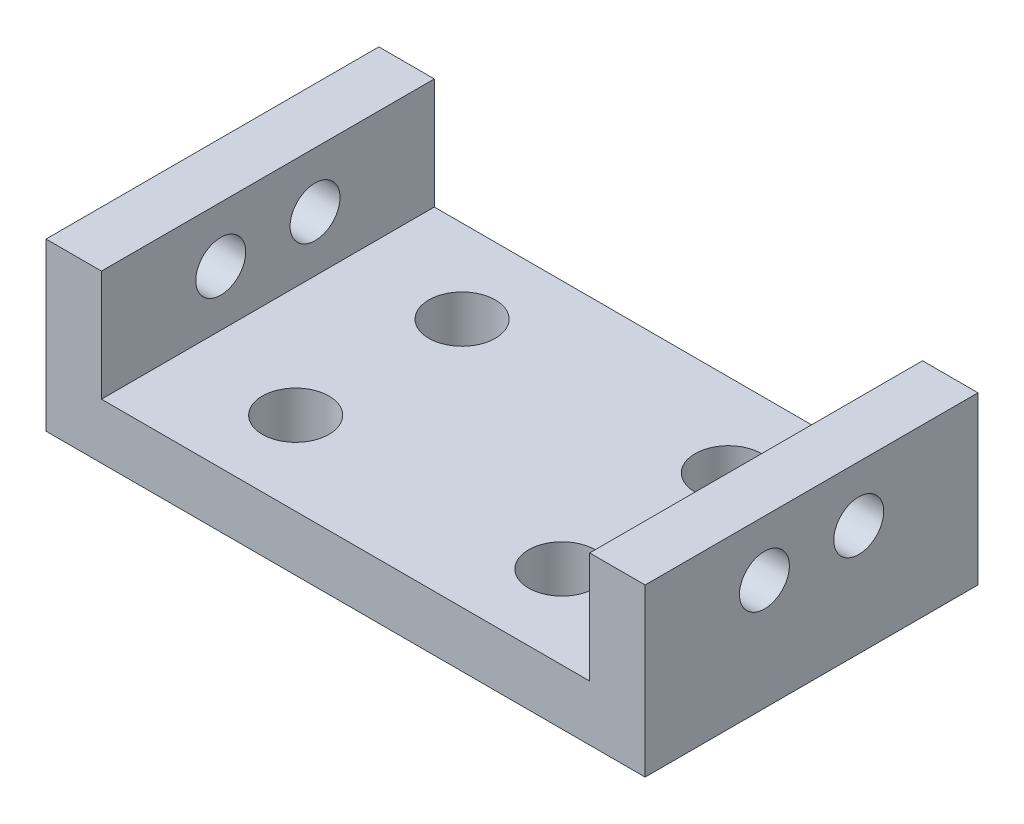
from build123d import *

# Parameters (mm, degrees)
SKETCH1_W             = 54
SKETCH1_H             = 30
BOSS_EXTRUDE1_DEPTH   = 15
SKETCH2_W             = 44
SKETCH2_H             = 10
CUT_EXTRUDE1_DEPTH    = 44.058100283
SKETCH3_R             = 2.25
CUT_EXTRUDE2_DEPTH    = 59.017238817
F_6_0MM_DOWEL_HOLE2_D = 6


with BuildPart() as part:
    # Sketch1 → Boss-Extrude1 (new body)
    with BuildSketch(Plane(origin=(0, 0, 0), x_dir=(1, 0, 0), z_dir=(0, 1, 0))):
        Rectangle(SKETCH1_W, SKETCH1_H)
    extrude(amount=BOSS_EXTRUDE1_DEPTH)

    # Sketch2 → Cut-Extrude1 (cut, through all)
    with BuildSketch(Plane(origin=(0, 0, -15), x_dir=(-1, 0, 0), z_dir=(0, 0, -1))):
        with Locations((0, 10)):
            Rectangle(SKETCH2_W, SKETCH2_H)
    extrude(amount=-CUT_EXTRUDE1_DEPTH, mode=Mode.SUBTRACT)

    # Sketch3 → Cut-Extrude2 (cut, through all)
    with BuildSketch(Plane.ZY.offset(27)):
        with Locations((-4.25, 10)):
            Circle(SKETCH3_R)
        with Locations((4.25, 10)):
            Circle(SKETCH3_R)
    extrude(amount=-CUT_EXTRUDE2_DEPTH, mode=Mode.SUBTRACT)

    # Ø6.0mm Dowel Hole2 (through all)
    with Locations(Plane(origin=(-12, 0, 7.5), x_dir=(0, 0, -1), z_dir=(0, -1, 0))):
        with Locations((0, 0), (0, 24), (15, 24), (15, 0)):
            Hole(F_6_0MM_DOWEL_HOLE2_D / 2)


solid = part.part
